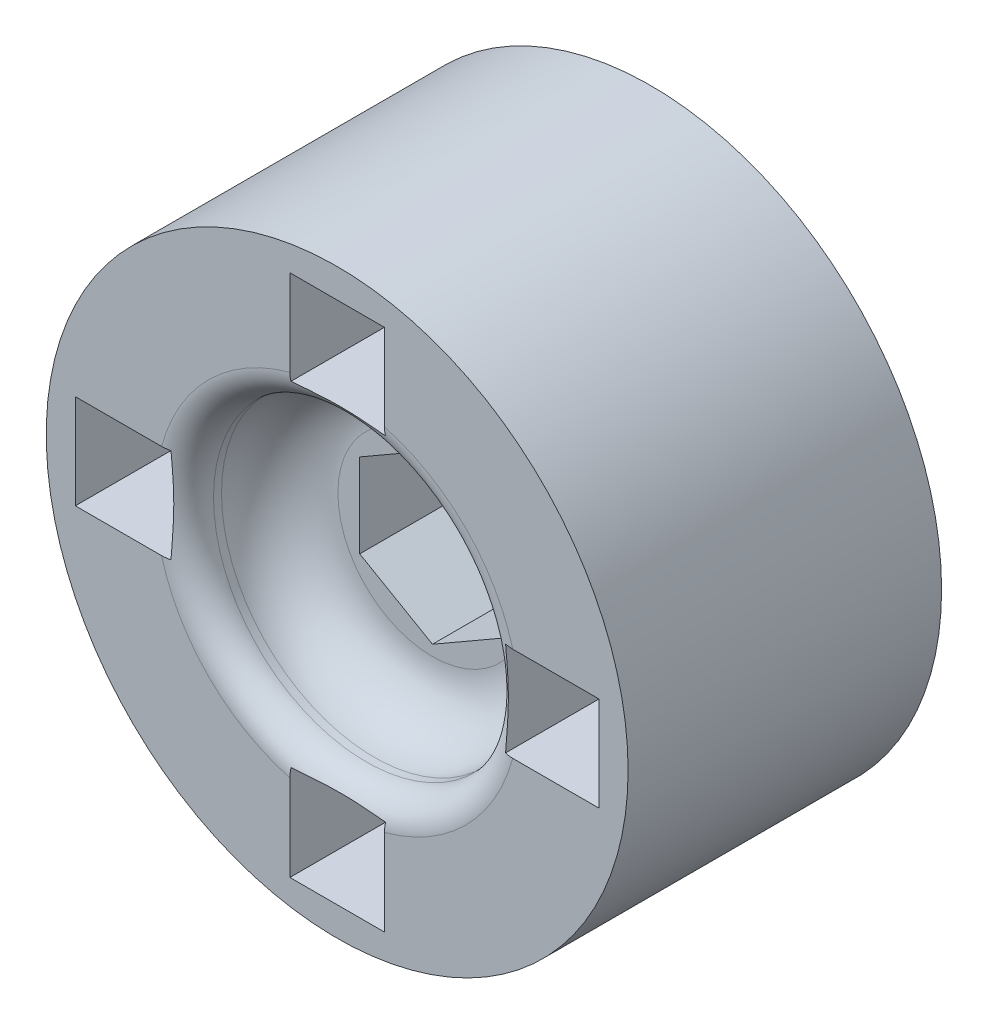
from build123d import *

# Parameters (mm, degrees)
SKETCH1_R                       = 20
SKETCH1_R_2                     = 1
BOSS_EXTRUDE1_DEPTH             = 21.55
TAP_DRILL_FOR_M5X0_8_TAP1_D     = 4.2
TAP_DRILL_FOR_M5X0_8_TAP1_DEPTH = 5
TAP_DRILL_FOR_M5X0_8_TAP1_TIP   = 1.2618073
SKETCH4_W                       = 6.5
SKETCH4_H                       = 6.5
CUT_EXTRUDE1_DEPTH              = 19.05
CIRPATTERN1_COUNT               = 4
SKETCH5_R                       = 6
SKETCH5_R_2                     = 5
SKETCH5_R_3                     = 1
CUT_EXTRUDE2_DEPTH              = 1
CUT_EXTRUDE3_START              = -21.55
SKETCH6_W                       = 10
SKETCH6_H                       = 5.7725
SKETCH6_R                       = 2.1
CUT_EXTRUDE3_DEPTH              = 21.55
SKETCH7_R                       = 10.5
CUT_EXTRUDE4_DEPTH              = 6.55
FILLET4_R                       = 2
FILLET5_R                       = 4


with BuildPart() as part:
    # Sketch1 → Boss-Extrude1 (new body)
    with BuildSketch(Plane.XY):
        with Locations((-11.822558412, 14.529752947)):
            Circle(SKETCH1_R)
        with Locations((-11.822558412, 14.529752947)):
            Circle(SKETCH1_R_2, mode=Mode.SUBTRACT)
    extrude(amount=BOSS_EXTRUDE1_DEPTH)

    # Tap Drill for M5x0.8 Tap1
    with Locations(Plane.XY.offset(21.55)):
        with Locations((-11.822558412, 14.529752947)):
            Hole(TAP_DRILL_FOR_M5X0_8_TAP1_D / 2, depth=TAP_DRILL_FOR_M5X0_8_TAP1_DEPTH)
            with Locations((0, 0, -(TAP_DRILL_FOR_M5X0_8_TAP1_DEPTH + TAP_DRILL_FOR_M5X0_8_TAP1_TIP / 2))):  # 118° drill point
                Cone(0, TAP_DRILL_FOR_M5X0_8_TAP1_D / 2, TAP_DRILL_FOR_M5X0_8_TAP1_TIP, mode=Mode.SUBTRACT)

    # Sketch4 → Cut-Extrude1 (cut)
    with BuildSketch(Plane.XY.offset(21.55)):
        with Locations((2.927441588, 14.529752947)):
            Rectangle(SKETCH4_W, SKETCH4_H)
    cut_extrude1 = extrude(amount=-CUT_EXTRUDE1_DEPTH, mode=Mode.SUBTRACT)

    # CirPattern1: Cut-Extrude1 ×4 about axis
    cirpattern1_axis = Axis((-11.822558412, 14.529752947, 0), (0, 0, 1))
    for i in range(1, CIRPATTERN1_COUNT):
        add(cut_extrude1.rotate(cirpattern1_axis, i * 360 / CIRPATTERN1_COUNT), mode=Mode.SUBTRACT)

    # Sketch5 → Cut-Extrude2 (cut)
    # profile 1 of 2: a face of its own
    with BuildSketch(Plane(origin=(0, 0, 0), x_dir=(-1, 0, 0), z_dir=(0, 0, -1))):
        with Locations((11.822558412, 14.529752947)):
            Circle(SKETCH5_R)
        with Locations((11.822558412, 14.529752947)):
            Circle(SKETCH5_R_2, mode=Mode.SUBTRACT)
    # profile 2 of 2: a face of its own
    with BuildSketch(Plane(origin=(0, 0, 0), x_dir=(-1, 0, 0), z_dir=(0, 0, -1))):
        with Locations((11.822558412, 14.529752947)):
            Circle(SKETCH5_R_2)
        with Locations((11.822558412, 14.529752947)):
            Circle(SKETCH5_R_3, mode=Mode.SUBTRACT)
    extrude(amount=-CUT_EXTRUDE2_DEPTH, mode=Mode.SUBTRACT)

    # Sketch6 → Cut-Extrude3 (cut)
    # profile 1 of 4: a face of its own
    with BuildSketch(Plane.XY.offset(21.55).offset(CUT_EXTRUDE3_START)):
        with Locations((-11.822558412, 14.529752947)):
            Rectangle(SKETCH6_W, SKETCH6_H)
        with Locations((-11.822558412, 14.529752947)):
            Circle(SKETCH6_R, mode=Mode.SUBTRACT)
    # profile 2 of 4: a face of its own
    with BuildSketch(Plane.XY.offset(21.55).offset(CUT_EXTRUDE3_START)):
        with Locations((-11.822558412, 14.529752947)):
            Circle(SKETCH6_R)
    # profile 3 of 4: a face of its own
    with BuildSketch(Plane.XY.offset(21.55).offset(CUT_EXTRUDE3_START)):
        Polygon((-11.822558412, 20.295742519), (-6.822558412, 17.416002947), (-16.822558412, 17.416002947), align=None)
    # profile 4 of 4: a face of its own
    with BuildSketch(Plane.XY.offset(21.55).offset(CUT_EXTRUDE3_START)):
        Polygon((-11.822558412, 8.763763375), (-16.822558412, 11.643502947), (-6.822558412, 11.643502947), align=None)
    extrude(amount=CUT_EXTRUDE3_DEPTH, mode=Mode.SUBTRACT)

    # Sketch7 → Cut-Extrude4 (cut)
    with BuildSketch(Plane.XY.offset(21.55)):
        with Locations((-11.822558412, 14.529752947)):
            Circle(SKETCH7_R)
    extrude(amount=-CUT_EXTRUDE4_DEPTH, mode=Mode.SUBTRACT)

    # Fillet4
    # the kernel refuses this fillet: 2 mm, written as the material it takes off along each edge
    with BuildSketch(Plane(origin=(-11.822558412, 14.529752947, 21.55), x_dir=(1, 0, 0), z_dir=(0, -1, 0))) as fillet4_piece_1:
        with BuildLine():
            CenterArc((10.5 + FILLET4_R, -FILLET4_R), FILLET4_R, 90, 90)
            Line((10.5, -FILLET4_R), (10.5, 0))
            Line((10.5, 0), (10.5 + FILLET4_R, 0))
        make_face()
    revolve(axis=Axis((-11.822558412, 14.529752947, 21.55), (0, 0, 1)), mode=Mode.SUBTRACT)

    # Fillet5
    fillet5_edges = [part.edges().sort_by_distance(p)[0] for p in [
        (-22.322558412, 14.529752947, 15),
    ]]
    fillet(fillet5_edges, radius=FILLET5_R)


solid = part.part
